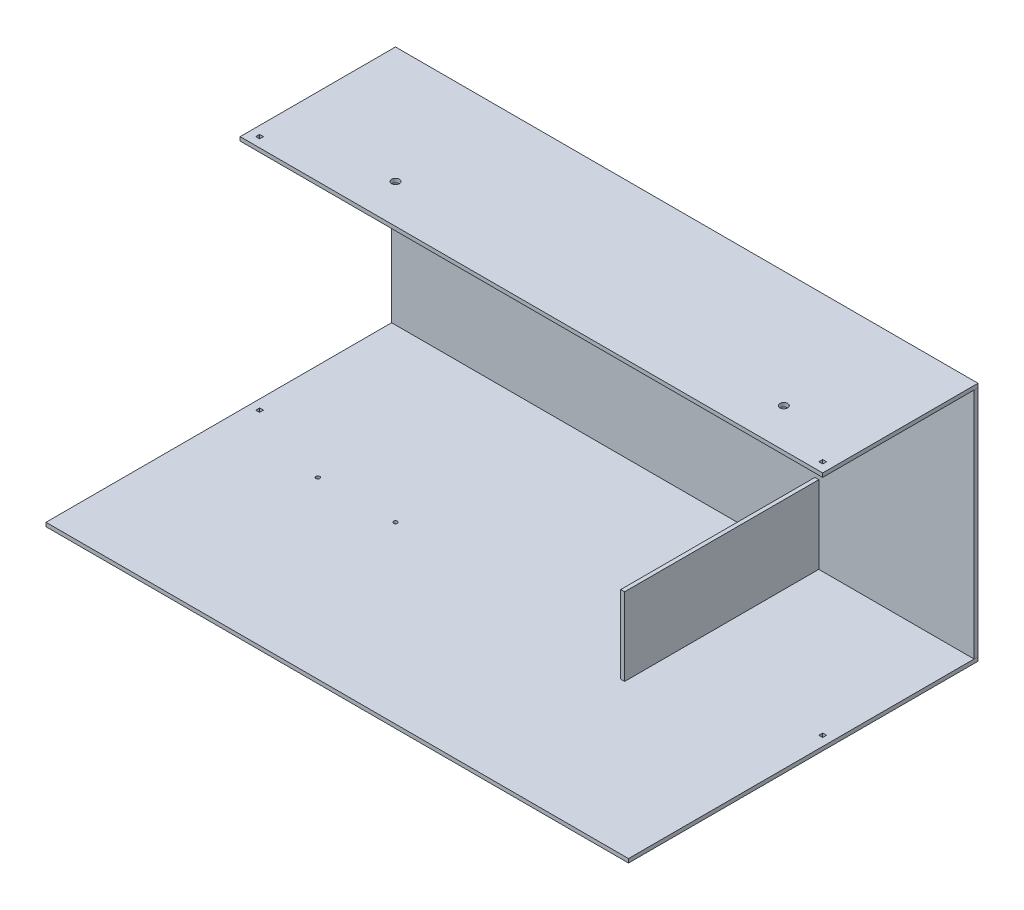
from build123d import *

# Parameters (mm, degrees)
SKETCH1_W               = 750
SKETCH1_H               = 450
BOSS_EXTRUDE1_DEPTH     = 310
SKETCH8_W               = 750
SKETCH8_H               = 300
CUT_EXTRUDE1_DEPTH      = 445
SKETCH15_W              = 5
SKETCH15_H              = 250
BOSS_EXTRUDE8_DEPTH     = 100
CUT_EXTRUDE2_DEPTH      = 537.050370768
CUT_EXTRUDE2_DEPTH_BACK = 10
SKETCH16_R              = 5
SKETCH16_W              = 750
SKETCH16_H              = 250
SKETCH18_W              = 5
SKETCH18_H              = 5
CUT_EXTRUDE3_DEPTH      = 537.050370768
SKETCH10_R              = 2.5
CUT_EXTRUDE4_DEPTH      = 534.174455502
SPLIT1_START            = 305
SPLIT1_OUTLINE_W        = 750
SPLIT1_OUTLINE_H        = 200
SPLIT1_OUTLINE_W_2      = 5
SPLIT1_OUTLINE_H_2      = 5
SPLIT1_OUTLINE_R        = 5
SPLIT1_DEPTH            = 5
SPLIT1_2_OUTLINE_W      = 750
SPLIT1_2_OUTLINE_H      = 450
SPLIT1_2_OUTLINE_W_2    = 5
SPLIT1_2_OUTLINE_H_2    = 5
SPLIT1_2_OUTLINE_R      = 2.5
SPLIT1_2_DEPTH          = 5
SPLIT1_3_OUTLINE_W      = 750
SPLIT1_3_OUTLINE_H      = 200
SPLIT1_3_OUTLINE_W_2    = 5
SPLIT1_3_OUTLINE_H_2    = 5
SPLIT1_3_OUTLINE_R      = 5
SPLIT1_3_DEPTH          = 5
SPLIT1_4_OUTLINE_W      = 750
SPLIT1_4_OUTLINE_H      = 450
SPLIT1_4_OUTLINE_W_2    = 5
SPLIT1_4_OUTLINE_H_2    = 5
SPLIT1_4_OUTLINE_R      = 2.5
SPLIT1_4_DEPTH          = 5


# Read off the part's stored shape, not the designer's step: Split1
with BuildPart() as part:
    # Sketch1 → Boss-Extrude1 (new body)
    with BuildSketch(Plane(origin=(0, 0, 0), x_dir=(1, 0, 0), z_dir=(0, 1, 0))):
        Rectangle(SKETCH1_W, SKETCH1_H)
    extrude(amount=BOSS_EXTRUDE1_DEPTH)

    # Sketch8 → Cut-Extrude1 (cut)
    with BuildSketch(Plane.XY.offset(225)):
        with Locations((0, 155)):
            Rectangle(SKETCH8_W, SKETCH8_H)
    extrude(amount=-CUT_EXTRUDE1_DEPTH, mode=Mode.SUBTRACT)

    # Sketch15 → Boss-Extrude8 (add)
    with BuildSketch(Plane(origin=(0, 5, 0), x_dir=(1, 0, 0), z_dir=(0, 1, 0))):
        with Locations((172.5, 95)):
            Rectangle(SKETCH15_W, SKETCH15_H)
    extrude(amount=BOSS_EXTRUDE8_DEPTH)

    # Sketch16 → Cut-Extrude2 (cut, two sides: drawn at the far end of the back side and taken through both)
    with BuildSketch(Plane(origin=(0, 310, 0), x_dir=(1, 0, 0), z_dir=(0, 1, 0)).offset(-CUT_EXTRUDE2_DEPTH_BACK)):
        with Locations(Location((275, 75, 0), (0, 0, 90))):
            Circle(SKETCH16_R)
        with Locations(Location((-225, 75, 0), (0, 0, 90))):
            Circle(SKETCH16_R)
        with Locations((0, -100)):
            Rectangle(SKETCH16_W, SKETCH16_H)
    extrude(amount=CUT_EXTRUDE2_DEPTH + CUT_EXTRUDE2_DEPTH_BACK, mode=Mode.SUBTRACT)

    # Sketch18 → Cut-Extrude3 (cut, through all)
    with BuildSketch(Plane(origin=(0, 310, 0), x_dir=(1, 0, 0), z_dir=(0, 1, 0))):
        with Locations((-362.5, 37.5)):
            Rectangle(SKETCH18_W, SKETCH18_H)
        with Locations((362.5, 37.5)):
            Rectangle(SKETCH18_W, SKETCH18_H)
    extrude(amount=-CUT_EXTRUDE3_DEPTH, mode=Mode.SUBTRACT)

    # Sketch10 → Cut-Extrude4 (cut, through all)
    with BuildSketch(Plane(origin=(0, 5, 0), x_dir=(1, 0, 0), z_dir=(0, 1, 0))):
        with Locations(Location((-250, 0, 0), (0, 0, 270))):
            Circle(SKETCH10_R)
        with Locations(Location((-150, 0, 0), (0, 0, 270))):
            Circle(SKETCH10_R)
    extrude(amount=-CUT_EXTRUDE4_DEPTH, mode=Mode.SUBTRACT)

    # Split1 2 outline → Split1 2 (cut)
    with BuildSketch(Plane(origin=(0, 0, 0), x_dir=(1, 0, 0), z_dir=(0, 1, 0))):
        Rectangle(SPLIT1_2_OUTLINE_W, SPLIT1_2_OUTLINE_H)
        with Locations((-362.5, 37.5)):
            Rectangle(SPLIT1_2_OUTLINE_W_2, SPLIT1_2_OUTLINE_H_2, mode=Mode.SUBTRACT)
        with Locations((362.5, 37.5)):
            Rectangle(SPLIT1_2_OUTLINE_W_2, SPLIT1_2_OUTLINE_H_2, mode=Mode.SUBTRACT)
        with Locations((-150, 0)):
            Circle(SPLIT1_2_OUTLINE_R, mode=Mode.SUBTRACT)
        with Locations((-250, 0)):
            Circle(SPLIT1_2_OUTLINE_R, mode=Mode.SUBTRACT)
    extrude(amount=SPLIT1_2_DEPTH, mode=Mode.SUBTRACT)

    # Split1 3 outline → Split1 3 (cut)
    with BuildSketch(Plane(origin=(0, 0, 0), x_dir=(1, 0, 0), z_dir=(0, 1, 0)).offset(SPLIT1_START)):
        with Locations((0, 125)):
            Rectangle(SPLIT1_3_OUTLINE_W, SPLIT1_3_OUTLINE_H)
        with Locations((-362.5, 37.5)):
            Rectangle(SPLIT1_3_OUTLINE_W_2, SPLIT1_3_OUTLINE_H_2, mode=Mode.SUBTRACT)
        with Locations((-225, 75)):
            Circle(SPLIT1_3_OUTLINE_R, mode=Mode.SUBTRACT)
        with Locations((362.5, 37.5)):
            Rectangle(SPLIT1_3_OUTLINE_W_2, SPLIT1_3_OUTLINE_H_2, mode=Mode.SUBTRACT)
        with Locations((275, 75)):
            Circle(SPLIT1_3_OUTLINE_R, mode=Mode.SUBTRACT)
    extrude(amount=SPLIT1_3_DEPTH, mode=Mode.SUBTRACT)


with BuildPart() as body_2:
    # Split1 outline → Split1 (new body)
    with BuildSketch(Plane(origin=(0, 0, 0), x_dir=(1, 0, 0), z_dir=(0, 1, 0)).offset(SPLIT1_START)):
        with Locations((0, 125)):
            Rectangle(SPLIT1_OUTLINE_W, SPLIT1_OUTLINE_H)
        with Locations((-362.5, 37.5)):
            Rectangle(SPLIT1_OUTLINE_W_2, SPLIT1_OUTLINE_H_2, mode=Mode.SUBTRACT)
        with Locations((-225, 75)):
            Circle(SPLIT1_OUTLINE_R, mode=Mode.SUBTRACT)
        with Locations((362.5, 37.5)):
            Rectangle(SPLIT1_OUTLINE_W_2, SPLIT1_OUTLINE_H_2, mode=Mode.SUBTRACT)
        with Locations((275, 75)):
            Circle(SPLIT1_OUTLINE_R, mode=Mode.SUBTRACT)
    extrude(amount=SPLIT1_DEPTH)


with BuildPart() as body_3:
    # Split1 4 outline → Split1 4 (new body)
    with BuildSketch(Plane(origin=(0, 0, 0), x_dir=(1, 0, 0), z_dir=(0, 1, 0))):
        Rectangle(SPLIT1_4_OUTLINE_W, SPLIT1_4_OUTLINE_H)
        with Locations((-362.5, 37.5)):
            Rectangle(SPLIT1_4_OUTLINE_W_2, SPLIT1_4_OUTLINE_H_2, mode=Mode.SUBTRACT)
        with Locations((-250, 0)):
            Circle(SPLIT1_4_OUTLINE_R, mode=Mode.SUBTRACT)
        with Locations((-150, 0)):
            Circle(SPLIT1_4_OUTLINE_R, mode=Mode.SUBTRACT)
        with Locations((362.5, 37.5)):
            Rectangle(SPLIT1_4_OUTLINE_W_2, SPLIT1_4_OUTLINE_H_2, mode=Mode.SUBTRACT)
    extrude(amount=SPLIT1_4_DEPTH)


solid = Compound([part.part, body_2.part, body_3.part])
